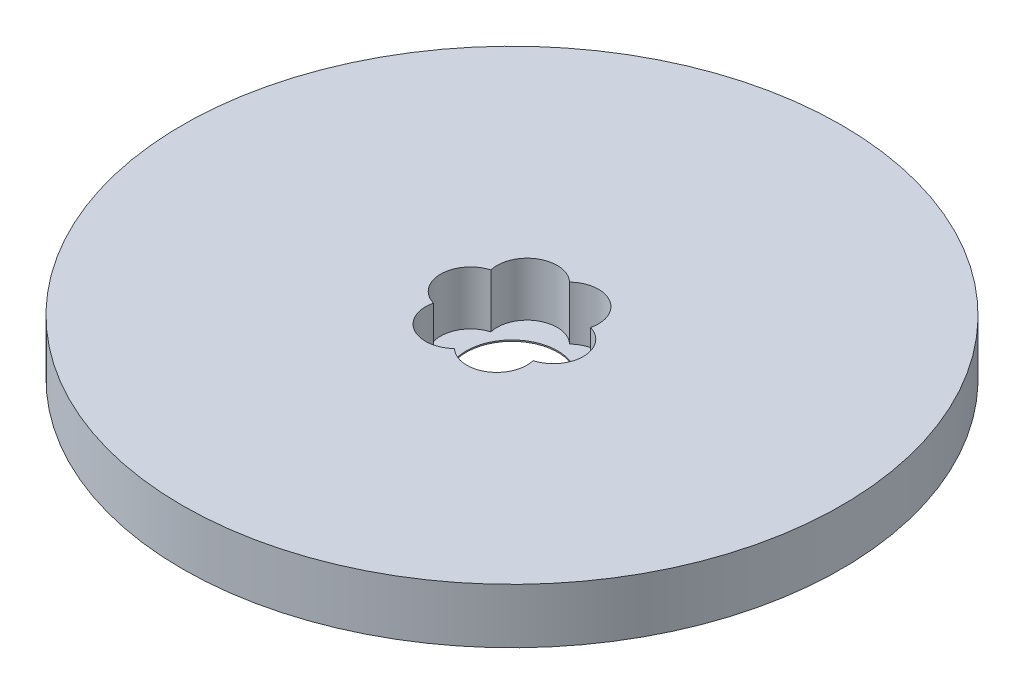
from build123d import *

# Parameters (mm, degrees)
SKETCH1_R           = 90
BOSS_EXTRUDE1_DEPTH = 15
SKETCH2_R           = 12.5
CUT_EXTRUDE1_DEPTH  = 129.16005618
SKETCH3_R           = 8.190815025
CUT_EXTRUDE2_DEPTH  = 14.66151422
CIRPATTERN1_COUNT   = 6


with BuildPart() as part:
    # Sketch1 → Boss-Extrude1 (new body)
    with BuildSketch(Plane(origin=(0, 0, 0), x_dir=(1, 0, 0), z_dir=(0, 1, 0))):
        Circle(SKETCH1_R)
    extrude(amount=BOSS_EXTRUDE1_DEPTH)

    # Sketch2 → Cut-Extrude1 (cut, through all)
    with BuildSketch(Plane(origin=(0, 0, 0), x_dir=(1, 0, 0), z_dir=(0, 1, 0))):
        Circle(SKETCH2_R)
    extrude(amount=CUT_EXTRUDE1_DEPTH, mode=Mode.SUBTRACT)

    # Sketch3 → Cut-Extrude2 (cut)
    with BuildSketch(Plane(origin=(0, 15, 0), x_dir=(1, 0, 0), z_dir=(0, 1, 0))):
        with Locations((-11.303338173, 0)):
            Circle(SKETCH3_R)
    cut_extrude2 = extrude(amount=-CUT_EXTRUDE2_DEPTH, mode=Mode.SUBTRACT)

    # CirPattern1: Cut-Extrude2 ×6 about axis
    cirpattern1_axis = Axis((0, 0, 0), (0, 1, 0))
    for i in range(1, CIRPATTERN1_COUNT):
        add(cut_extrude2.rotate(cirpattern1_axis, i * 360 / CIRPATTERN1_COUNT), mode=Mode.SUBTRACT)


solid = part.part
